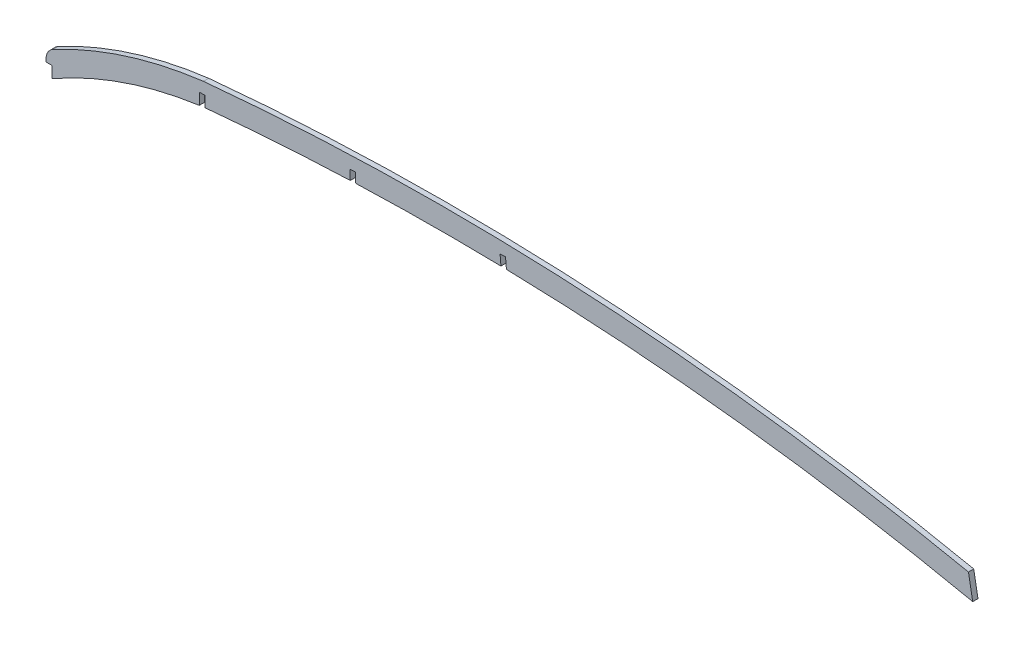
from build123d import *

# Parameters (mm, degrees)
BOSS_EXTRUDE1_DEPTH = 1.5875


with BuildPart() as part:
    # Sketch1 → Boss-Extrude1 (new, symmetric)
    with BuildSketch(Plane.XY):
        with BuildLine():
            ThreePointArc((4.300521626, 108.758517405), (1.157792804, 105.775489723), (0, 101.6))
            Line((0, 101.6), (0, 100.055269774))
            Line((0, 100.055269774), (3.749926944, 100.055269774))
            Line((3.749926944, 100.055269774), (3.749926944, 93.197269774))
            ThreePointArc((3.749926944, 93.197269774), (46.592607477, 112.602219611), (92.329, 123.567152459))
            Line((92.329, 123.567152459), (92.329, 130.517973266))
            Line((92.329, 130.517973266), (95.631, 130.517973266))
            Line((95.631, 130.517973266), (95.631, 124.010897007))
            ThreePointArc((95.631, 124.010897007), (95.971054745, 124.054032816), (96.311168805, 124.096698424))
            ThreePointArc((96.311168805, 124.096698424), (139.761460521, 127.601280315), (183.294042864, 129.86495412))
            Line((183.294042864, 129.86495412), (183.050163268, 135.689672274))
            Line((183.050163268, 135.689672274), (186.349272737, 135.827805221))
            Line((186.349272737, 135.827805221), (186.59387592, 129.985805221))
            ThreePointArc((186.59387592, 129.985805221), (230.30851429, 130.913472194), (274.031797499, 130.589930281))
            Line((274.031797499, 130.589930281), (273.51809872, 136.557636124))
            Line((273.51809872, 136.557636124), (276.807932827, 136.840824305))
            Line((276.807932827, 136.840824305), (277.352525484, 130.514220253))
            ThreePointArc((277.352525484, 130.514220253), (418.553478483, 120.58290755), (558.229469453, 97.627349478))
            Line((558.229469453, 97.627349478), (555.638244479, 111.822940798))
            ThreePointArc((555.638244479, 111.822940798), (326.208122032, 141.94293007), (94.854415026, 137.375973266))
            ThreePointArc((94.854415026, 137.375973266), (48.266347056, 127.216011607), (4.300521626, 108.758517405))
        make_face()
    extrude(amount=BOSS_EXTRUDE1_DEPTH, both=True)


solid = part.part
